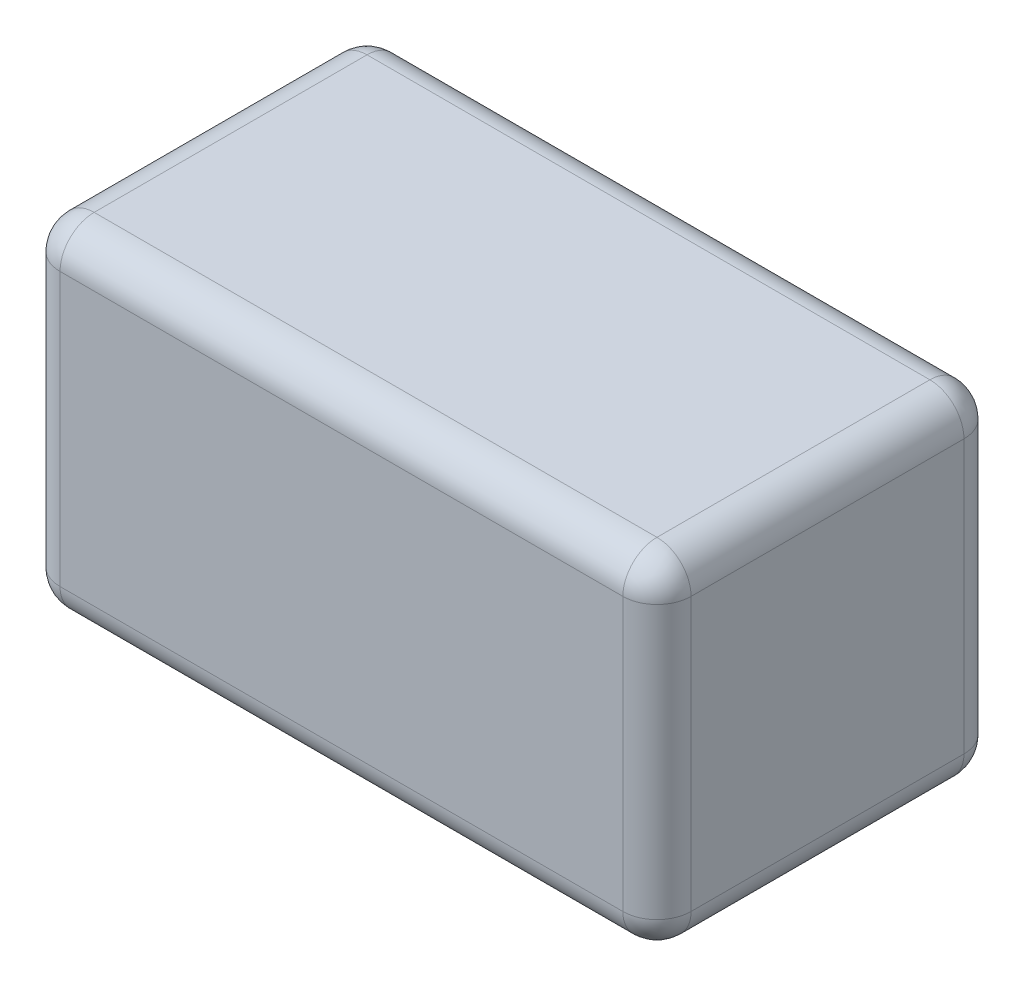
from build123d import *

# Parameters (mm, degrees)
SKETCH_1_W      = 74
SKETCH_1_H      = 40
EXTRUDE_1_DEPTH = 20
FILLET_1_R      = 4


with BuildPart() as part:
    # 草图1 → 凸台-拉伸1 (new, symmetric)
    with BuildSketch(Plane.XY):
        Rectangle(SKETCH_1_W, SKETCH_1_H)
    extrude(amount=EXTRUDE_1_DEPTH, both=True)

    # 圆角1
    fillet_1_edges = [part.edges().sort_by_distance(p)[0] for p in [
        (37, 0, -20),
        (0, 20, -20),
        (-37, 0, -20),
        (0, -20, -20),
        (37, 0, 20),
        (0, 20, 20),
        (-37, 0, 20),
        (0, -20, 20),
        (37, -20, 0),
        (-37, -20, 0),
        (-37, 20, 0),
        (37, 20, 0),
    ]]
    fillet(fillet_1_edges, radius=FILLET_1_R)


solid = part.part
